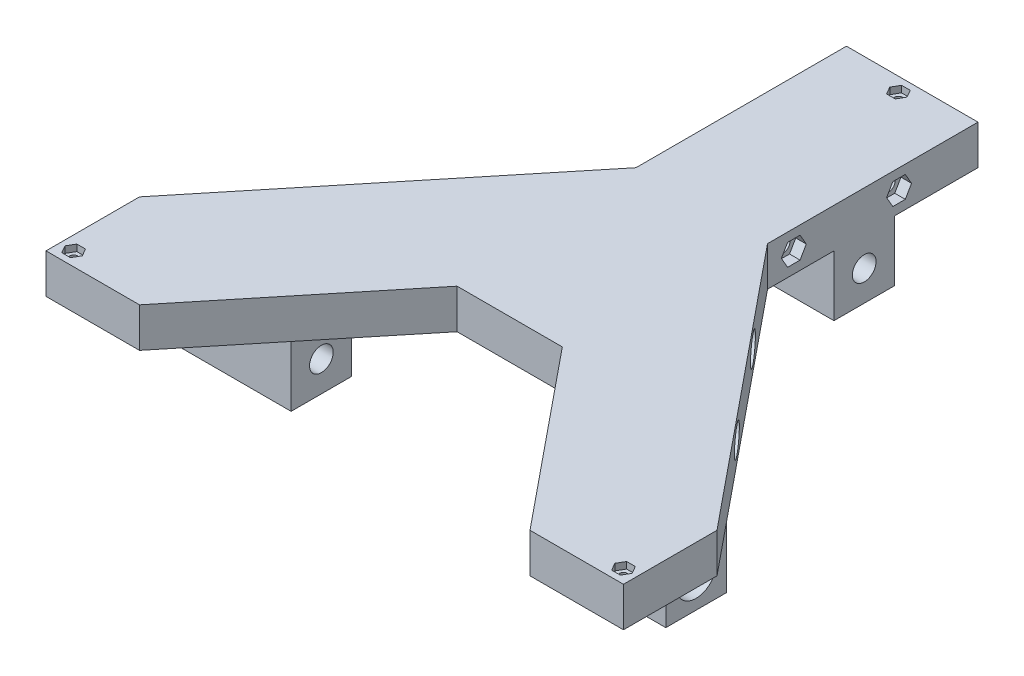
from build123d import *

# Parameters (mm, degrees)
BOSS_EXTRUDE1_DEPTH      = 15
SKETCH4_R                = 2.55
CUT_EXTRUDE1_DEPTH       = 311.78207799
CUT_EXTRUDE3_DEPTH       = 258.997698633
CUT_EXTRUDE3_DEPTH_BACK  = 3.5
SKETCH5_R                = 4.5
SKETCH6_R                = 5
CUT_EXTRUDE4_DEPTH       = 258.997698633
CUT_EXTRUDE5_DEPTH       = 4
SKETCH8_R                = 1.6
CUT_EXTRUDE6_DEPTH       = 246.866452571
CUT_EXTRUDE7_DEPTH       = 2.5
SKETCH10_W               = 50
SKETCH10_H               = 23
SKETCH10_W_2             = 45.759160871
BOSS_EXTRUDE2_DEPTH      = 23
CUT_EXTRUDE8_START       = -24
SKETCH11_R               = 7.6
CUT_EXTRUDE8_DEPTH       = 325.431928593
SKETCH12_R               = 4.5
CUT_EXTRUDE9_DEPTH       = 301.431928593
SKETCH13_R               = 4.5
CUT_EXTRUDE10_DEPTH      = 259.586180025
CUT_EXTRUDE11_DEPTH      = 12.5
CUT_EXTRUDE11_DEPTH_BACK = 12.5
SKETCH14_R               = 7.6


with BuildPart() as part:
    # Sketch1 → Boss-Extrude1 (new body)
    with BuildSketch(Plane(origin=(0, 0, 0), x_dir=(1, 0, 0), z_dir=(0, 1, 0))):
        Polygon((25, 0), (-25, 0), (-25, -80), (-109.75, -183.961915416), (-109.75, -219.5), (-74.211915416, -219.5), (-20, -152.998825191), (20, -152.998825191), (74.211915416, -219.5), (109.75, -219.5), (109.75, -183.961915416), (25, -80), align=None)
    extrude(amount=BOSS_EXTRUDE1_DEPTH)

    # Sketch4 → Cut-Extrude1 (cut, through all)
    with BuildSketch(Plane.ZY.offset(109.75)):
        with Locations((30, 7.5)):
            Circle(SKETCH4_R)
        with Locations((70, 7.5)):
            Circle(SKETCH4_R)
        with Locations((110, 7.5)):
            Circle(SKETCH4_R)
        with Locations((142.998825191, 7.5)):
            Circle(SKETCH4_R)
    extrude(amount=-CUT_EXTRUDE1_DEPTH, mode=Mode.SUBTRACT)

    # Sketch5 → Cut-Extrude3 (cut, two sides: drawn at the far end of the back side and taken through both)
    with BuildSketch(Plane.ZY.offset(25).offset(-CUT_EXTRUDE3_DEPTH_BACK)):
        with Locations((30, 7.5)):
            Circle(SKETCH5_R)
        with Locations((70, 7.5)):
            Circle(SKETCH5_R)
        with Locations((110, 7.5)):
            Circle(SKETCH5_R)
        with Locations((142.998825191, 7.5)):
            Circle(SKETCH5_R)
    extrude(amount=CUT_EXTRUDE3_DEPTH + CUT_EXTRUDE3_DEPTH_BACK, mode=Mode.SUBTRACT)

    # Sketch6 → Cut-Extrude4 (cut, through all)
    with BuildSketch(Plane(origin=(25, 0, 0), x_dir=(0, 0, -1), z_dir=(1, 0, 0))):
        with Locations((-142.998825191, 7.5)):
            Circle(SKETCH6_R)
        with Locations((-110, 7.5)):
            Circle(SKETCH6_R)
    extrude(amount=CUT_EXTRUDE4_DEPTH, mode=Mode.SUBTRACT)

    # Sketch7 → Cut-Extrude5 (cut)
    with BuildSketch(Plane(origin=(25, 0, 0), x_dir=(0, 0, -1), z_dir=(1, 0, 0))):
        Polygon((-34.734272207, 7.5), (-32.367136104, 3.4), (-27.632863896, 3.4), (-25.265727793, 7.5), (-27.632863896, 11.6), (-32.367136104, 11.6), align=None)
        Polygon((-74.734272207, 7.5), (-72.367136104, 3.4), (-67.632863896, 3.4), (-65.265727793, 7.5), (-67.632863896, 11.6), (-72.367136104, 11.6), align=None)
        Polygon((-114.734272207, 7.5), (-112.367136104, 3.4), (-107.632863896, 3.4), (-105.265727793, 7.5), (-107.632863896, 11.6), (-112.367136104, 11.6), align=None)
        Polygon((-147.733097398, 7.5), (-145.365961294, 3.4), (-140.631689087, 3.4), (-138.264552983, 7.5), (-140.631689087, 11.6), (-145.365961294, 11.6), align=None)
    extrude(amount=-CUT_EXTRUDE5_DEPTH, mode=Mode.SUBTRACT)

    # Sketch8 → Cut-Extrude6 (cut, through all)
    with BuildSketch(Plane(origin=(0, 15, 0), x_dir=(1, 0, 0), z_dir=(0, 1, 0))):
        with Locations((0, -5.25)):
            Circle(SKETCH8_R)
        with Locations((-104.5, -214.25)):
            Circle(SKETCH8_R)
        with Locations((104.5, -214.25)):
            Circle(SKETCH8_R)
    extrude(amount=-CUT_EXTRUDE6_DEPTH, mode=Mode.SUBTRACT)

    # Sketch9 → Cut-Extrude7 (cut)
    with BuildSketch(Plane(origin=(0, 15, 0), x_dir=(1, 0, 0), z_dir=(0, 1, 0))):
        Polygon((-101.209103466, -214.25), (-102.854551733, -211.4), (-106.145448267, -211.4), (-107.790896534, -214.25), (-106.145448267, -217.1), (-102.854551733, -217.1), align=None)
        Polygon((101.209103466, -214.25), (102.854551733, -217.1), (106.145448267, -217.1), (107.790896534, -214.25), (106.145448267, -211.4), (102.854551733, -211.4), align=None)
        Polygon((3.290896534, -5.25), (1.645448267, -2.4), (-1.645448267, -2.4), (-3.290896534, -5.25), (-1.645448267, -8.1), (1.645448267, -8.1), align=None)
    extrude(amount=-CUT_EXTRUDE7_DEPTH, mode=Mode.SUBTRACT)

    # Sketch10 → Boss-Extrude2 (add)
    with BuildSketch(Plane.XZ):
        with Locations((0, 43.25)):
            Rectangle(SKETCH10_W, SKETCH10_H)
        with Locations((71.208820555, 176.25)):
            Rectangle(SKETCH10_W_2, SKETCH10_H)
        with Locations((-71.208820555, 176.25)):
            Rectangle(SKETCH10_W_2, SKETCH10_H)
    extrude(amount=BOSS_EXTRUDE2_DEPTH)

    # Sketch11 → Cut-Extrude8 (cut)
    with BuildSketch(Plane.ZY.offset(94.08840099).offset(CUT_EXTRUDE8_START)):
        with Locations((176.25, -11.5)):
            Circle(SKETCH11_R)
    cut_extrude8 = extrude(amount=CUT_EXTRUDE8_DEPTH, mode=Mode.SUBTRACT)

    # Sketch12 → Cut-Extrude9 (cut, through all)
    with BuildSketch(Plane.ZY.offset(94.08840099)):
        with Locations((176.25, -11.5)):
            Circle(SKETCH12_R)
    extrude(amount=-CUT_EXTRUDE9_DEPTH, mode=Mode.SUBTRACT)

    # Mirror1: Cut-Extrude8 across plane
    add(cut_extrude8.mirror(Plane(origin=(0, 0, 0), x_dir=(0, 0, 1), z_dir=(1, 0, 0))), mode=Mode.SUBTRACT)

    # Sketch13 → Cut-Extrude10 (cut, through all)
    with BuildSketch(Plane.ZY.offset(25)):
        with Locations((43.25, -11.5)):
            Circle(SKETCH13_R)
    extrude(amount=-CUT_EXTRUDE10_DEPTH, mode=Mode.SUBTRACT)

    # Sketch14 → Cut-Extrude11 (cut, two sides: drawn at the far end of the back side and taken through both)
    with BuildSketch(Plane(origin=(0, 0, 0), x_dir=(0, 0, -1), z_dir=(1, 0, 0)).offset(-CUT_EXTRUDE11_DEPTH_BACK)):
        with Locations((-43.25, -11.5)):
            Circle(SKETCH14_R)
    extrude(amount=CUT_EXTRUDE11_DEPTH + CUT_EXTRUDE11_DEPTH_BACK, mode=Mode.SUBTRACT)


solid = part.part
